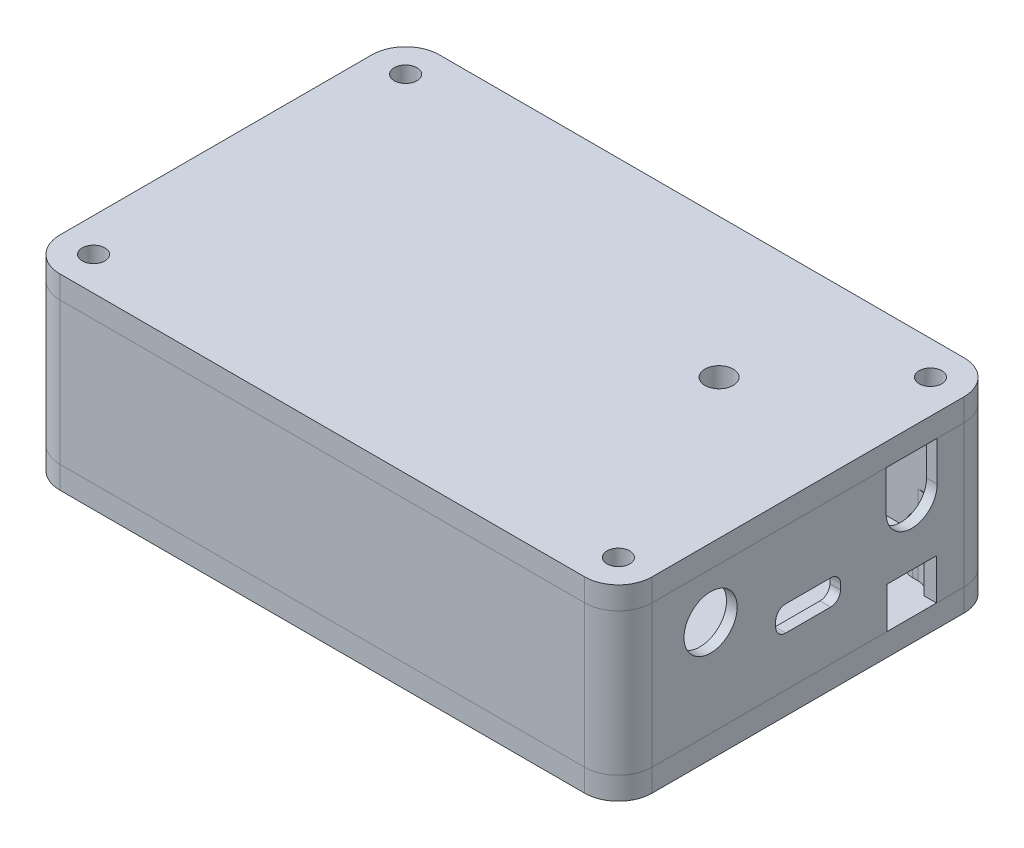
from build123d import *

# Parameters (mm, degrees)
BOSS_EXTRUDE1_DEPTH      = 20.07
SKETCH3_R                = 1.6
BOSS_EXTRUDE2_DEPTH      = 5.5
FILLET1_R                = 2.5
DATA_SIDE_REACH          = 102.265
SKETCH4_R                = 3.25
IO_SIDE_REACH            = 102.265
SKETCH5_R                = 2.15
SKETCH5_W                = 11.9
SKETCH5_H                = 7.3
PLUG_CLEARANCE_REACH     = 102.265
SKETCH10_W               = 11.9
SKETCH10_H               = 2.5
SKETCH10_H_2             = 0.5
MOVE_START               = 79.994994432
MOVE_FACE1_OUTLINE_R     = 3.75
MOVE_FACE1_OUTLINE_R_2   = 3.25
MOVE_FACE1_DEPTH         = 3.005005568
MOVE_START_2             = -3
MOVE_FACE1_2_OUTLINE_R   = 2.65
MOVE_FACE1_2_OUTLINE_R_2 = 2.15
MOVE_FACE1_2_DEPTH       = 82.994994432
MOVE_FACE2_BY            = 0.1
MOVE_FACE2_2_BY          = 0.1
MOVE_FACE2_3_BY          = 0.1
MOVE_FACE2_4_BY          = 0.1
MOVE_FACE2_5_BY          = 0.1
MOVE_FACE2_6_BY          = 0.1
MOVE_FACE2_7_BY          = 0.1
MOVE_FACE2_8_BY          = 0.1
MOVE_FACE2_9_BY          = 0.1
MOVE_FACE2_10_BY         = 0.1
MOVE_FACE3_BY            = 0.1
MOVE_FACE3_2_BY          = 0.1
MOVE_FACE3_3_BY          = 0.1
MOVE_FACE3_4_BY          = 0.1
SKETCH6_R                = 1.6
BOSS_EXTRUDE3_DEPTH      = 3.175
SKETCH7_R                = 2
CUT_EXTRUDE3_DEPTH       = 3.175


with BuildPart() as part:
    # Sketch2 → Boss-Extrude1 (new body)
    with BuildSketch(Plane(origin=(0, 0, 0), x_dir=(1, 0, 0), z_dir=(0, 1, 0))):
        with BuildLine():
            Line((77, 51.75), (3, 51.75))
            ThreePointArc((3, 51.75), (-0.358757211, 50.358757211), (-1.75, 47))
            Line((-1.75, 47), (-1.75, 3))
            ThreePointArc((-1.75, 3), (-0.358757211, -0.358757211), (3, -1.75))
            Line((3, -1.75), (77, -1.75))
            ThreePointArc((77, -1.75), (80.358757211, -0.358757211), (81.75, 3))
            Line((81.75, 3), (81.75, 47))
            ThreePointArc((81.75, 47), (80.358757211, 50.358757211), (77, 51.75))
        make_face()
        with BuildLine():
            Line((-0.25, 47), (-0.25, 3))
            ThreePointArc((-0.25, 3), (0.701902961, 0.701902961), (3, -0.25))
            Line((3, -0.25), (77, -0.25))
            ThreePointArc((77, -0.25), (79.298097039, 0.701902961), (80.25, 3))
            Line((80.25, 3), (80.25, 47))
            ThreePointArc((80.25, 47), (79.298097039, 49.298097039), (77, 50.25))
            Line((77, 50.25), (3, 50.25))
            ThreePointArc((3, 50.25), (0.701902961, 49.298097039), (-0.25, 47))
        make_face(mode=Mode.SUBTRACT)
    extrude(amount=BOSS_EXTRUDE1_DEPTH)

    # Sketch3 → Boss-Extrude2 (add)
    # profile 1 of 4: a face of its own
    with BuildSketch(Plane.XZ):
        with BuildLine():
            ThreePointArc((-0.25, -47), (0.701902961, -49.298097039), (3, -50.25))
            Line((3, -50.25), (5.5, -50.25))
            Line((5.5, -50.25), (5.5, -44.5))
            Line((5.5, -44.5), (-0.25, -44.5))
            Line((-0.25, -44.5), (-0.25, -47))
        make_face()
        with Locations(Location((3, -47, 0), (0, 0, 270))):
            Circle(SKETCH3_R, mode=Mode.SUBTRACT)
    # profile 2 of 4: a face of its own
    with BuildSketch(Plane.XZ):
        with BuildLine():
            Line((74.5, -44.5), (74.5, -50.25))
            Line((74.5, -50.25), (77, -50.25))
            ThreePointArc((77, -50.25), (79.298097039, -49.298097039), (80.25, -47))
            Line((80.25, -47), (80.25, -44.5))
            Line((80.25, -44.5), (74.5, -44.5))
        make_face()
        with Locations(Location((77, -47, 0), (0, 0, 270))):
            Circle(SKETCH3_R, mode=Mode.SUBTRACT)
    # profile 3 of 4: a face of its own
    with BuildSketch(Plane.XZ):
        with BuildLine():
            Line((74.5, -5.5), (80.25, -5.5))
            Line((80.25, -5.5), (80.25, -3))
            ThreePointArc((80.25, -3), (79.298097039, -0.701902961), (77, 0.25))
            Line((77, 0.25), (74.5, 0.25))
            Line((74.5, 0.25), (74.5, -5.5))
        make_face()
        with Locations(Location((77, -3, 0), (0, 0, 270))):
            Circle(SKETCH3_R, mode=Mode.SUBTRACT)
    # profile 4 of 4: a face of its own
    with BuildSketch(Plane.XZ):
        with BuildLine():
            Line((-0.25, -3), (-0.25, -5.5))
            Line((-0.25, -5.5), (5.5, -5.5))
            Line((5.5, -5.5), (5.5, 0.25))
            Line((5.5, 0.25), (3, 0.25))
            ThreePointArc((3, 0.25), (0.701902961, -0.701902961), (-0.25, -3))
        make_face()
        with Locations(Location((3, -3, 0), (0, 0, 270))):
            Circle(SKETCH3_R, mode=Mode.SUBTRACT)
    extrude(amount=-BOSS_EXTRUDE2_DEPTH)

    # Fillet1
    fillet1_edges = [part.edges().sort_by_distance(p)[0] for p in [
        (5.5, 2.75, 0.25),
        (5.5, 2.75, -5.5),
        (-0.25, 2.75, -5.5),
        (5.5, 2.75, -44.5),
        (5.5, 2.75, -50.25),
        (-0.25, 2.75, -44.5),
        (74.5, 2.75, -50.25),
        (74.5, 2.75, -44.5),
        (80.25, 2.75, -44.5),
        (74.5, 2.75, -5.5),
        (74.5, 2.75, 0.25),
        (80.25, 2.75, -5.5),
    ]]
    fillet(fillet1_edges, radius=FILLET1_R)

    # Sketch4 → data side (cut, up to next)
    with BuildSketch(Plane(origin=(81.75, 0, 0), x_dir=(0, 0, -1), z_dir=(1, 0, 0)), mode=Mode.PRIVATE) as data_side_sk1:
        with Locations((11.25, 13.5662)):
            Circle(SKETCH4_R)
    data_side_tool1 = extrude(data_side_sk1.sketch, amount=-DATA_SIDE_REACH, mode=Mode.PRIVATE) & part.part
    # Sketch4 → data side (cut, up to next)
    with BuildSketch(Plane(origin=(81.75, 0, 0), x_dir=(0, 0, -1), z_dir=(1, 0, 0)), mode=Mode.PRIVATE) as data_side_sk2:
        with BuildLine():
            Line((21.83, 7.07), (28.17, 7.07))
            ThreePointArc((28.17, 7.07), (29.089238816, 7.450761184), (29.47, 8.37))
            Line((29.47, 8.37), (29.47, 9.13))
            ThreePointArc((29.47, 9.13), (29.089238816, 10.049238816), (28.17, 10.43))
            Line((28.17, 10.43), (21.83, 10.43))
            ThreePointArc((21.83, 10.43), (20.910761184, 10.049238816), (20.53, 9.13))
            Line((20.53, 9.13), (20.53, 8.37))
            ThreePointArc((20.53, 8.37), (20.910761184, 7.450761184), (21.83, 7.07))
        make_face()
    data_side_tool2 = extrude(data_side_sk2.sketch, amount=-DATA_SIDE_REACH, mode=Mode.PRIVATE) & part.part
    # Sketch4 → data side (cut, up to next)
    with BuildSketch(Plane(origin=(81.75, 0, 0), x_dir=(0, 0, -1), z_dir=(1, 0, 0)), mode=Mode.PRIVATE) as data_side_sk3:
        with BuildLine():
            Line((36.5, 14.4662), (36.5, 20.07))
            ThreePointArc((36.5, 20.07), (39.6, 23.17), (42.7, 20.07))
            Line((42.7, 20.07), (42.7, 14.4662))
            ThreePointArc((42.7, 14.4662), (39.6, 11.3662), (36.5, 14.4662))
        make_face()
    data_side_tool3 = extrude(data_side_sk3.sketch, amount=-DATA_SIDE_REACH, mode=Mode.PRIVATE) & part.part
    # Sketch4 → data side (cut, up to next)
    with BuildSketch(Plane(origin=(81.75, 0, 0), x_dir=(0, 0, -1), z_dir=(1, 0, 0)), mode=Mode.PRIVATE) as data_side_sk4:
        Polygon((36.6, 2.78), (36.6, 5.28), (42.6, 5.28), (42.6, 2.704447838), (42.6, 0), (36.6, 0), align=None)
    data_side_tool4 = extrude(data_side_sk4.sketch, amount=-DATA_SIDE_REACH, mode=Mode.PRIVATE) & part.part
    add(data_side_tool1.solids().sort_by_distance((81.75, 13.5662, -11.25))[0], mode=Mode.SUBTRACT)
    add(data_side_tool2.solids().sort_by_distance((81.75, 8.75, -25))[0], mode=Mode.SUBTRACT)
    add(data_side_tool3.solids().sort_by_distance((81.75, 17.2681, -39.6))[0], mode=Mode.SUBTRACT)
    add(data_side_tool4.solids().sort_by_distance((81.75, 2.64, -39.6))[0], mode=Mode.SUBTRACT)

    # Sketch5 → io side (cut, up to next)
    with BuildSketch(Plane.ZY.offset(1.75), mode=Mode.PRIVATE) as io_side_sk1:
        with Locations((-11.97865482, 11.37450981)):
            Circle(SKETCH5_R)
    io_side_tool1 = extrude(io_side_sk1.sketch, amount=-IO_SIDE_REACH, mode=Mode.PRIVATE) & part.part
    # Sketch5 → io side (cut, up to next)
    with BuildSketch(Plane.ZY.offset(1.75), mode=Mode.PRIVATE) as io_side_sk2:
        with Locations((-25, 9.15)):
            Rectangle(SKETCH5_W, SKETCH5_H)
    io_side_tool2 = extrude(io_side_sk2.sketch, amount=-IO_SIDE_REACH, mode=Mode.PRIVATE) & part.part
    add(io_side_tool1.solids().sort_by_distance((-1.75, 11.37451, -11.978655))[0], mode=Mode.SUBTRACT)
    add(io_side_tool2.solids().sort_by_distance((-1.75, 9.15, -25))[0], mode=Mode.SUBTRACT)

    # Sketch10 → plug clearance (cut, up to next)
    with BuildSketch(Plane.ZY.offset(1.75), mode=Mode.PRIVATE) as plug_clearance_sk1:
        with Locations((-25, 4.25)):
            Rectangle(SKETCH10_W, SKETCH10_H)
    plug_clearance_tool1 = extrude(plug_clearance_sk1.sketch, amount=-PLUG_CLEARANCE_REACH, mode=Mode.PRIVATE) & part.part
    # Sketch10 → plug clearance (cut, up to next)
    with BuildSketch(Plane.ZY.offset(1.75), mode=Mode.PRIVATE) as plug_clearance_sk2:
        with Locations((-25, 13.05)):
            Rectangle(SKETCH10_W, SKETCH10_H_2)
    plug_clearance_tool2 = extrude(plug_clearance_sk2.sketch, amount=-PLUG_CLEARANCE_REACH, mode=Mode.PRIVATE) & part.part
    add(plug_clearance_tool1.solids().sort_by_distance((-1.75, 4.25, -25))[0], mode=Mode.SUBTRACT)
    add(plug_clearance_tool2.solids().sort_by_distance((-1.75, 13.05, -25))[0], mode=Mode.SUBTRACT)

    # Move Face1: read off the stored shape, not the designer's step
    # Move Face1 outline → Move Face1 (cut)
    # profile 1 of 3: a face of its own
    with BuildSketch(Plane.YZ.offset(MOVE_START)):
        Polygon((0, -42.6), (0, -43.1), (5.5, -43.1), (5.78, -43.1), (5.78, -36.1), (0, -36.1), (0, -36.6), (5.28, -36.6), (5.28, -42.6), align=None)
    # profile 2 of 3: a face of its own
    with BuildSketch(Plane.YZ.offset(MOVE_START)):
        with Locations((13.5662, -11.25)):
            Circle(MOVE_FACE1_OUTLINE_R)
        with Locations((13.5662, -11.25)):
            Circle(MOVE_FACE1_OUTLINE_R_2, mode=Mode.SUBTRACT)
    # profile 3 of 3: a face of its own
    with BuildSketch(Plane.YZ.offset(MOVE_START)):
        with BuildLine():
            ThreePointArc((14.4662, -36), (10.8662, -39.6), (14.4662, -43.2))
            Line((14.4662, -43.2), (20.07, -43.2))
            Line((20.07, -43.2), (20.07, -42.7))
            Line((20.07, -42.7), (14.4662, -42.7))
            ThreePointArc((14.4662, -42.7), (11.3662, -39.6), (14.4662, -36.5))
            Line((14.4662, -36.5), (20.07, -36.5))
            Line((20.07, -36.5), (20.07, -36))
            Line((20.07, -36), (14.4662, -36))
        make_face()
    extrude(amount=MOVE_FACE1_DEPTH, mode=Mode.SUBTRACT)

    # Move Face1 2 outline → Move Face1 2 (cut)
    with BuildSketch(Plane.YZ.offset(MOVE_START_2)):
        with Locations((11.37450981, -11.97865482)):
            Circle(MOVE_FACE1_2_OUTLINE_R)
        with Locations((11.37450981, -11.97865482)):
            Circle(MOVE_FACE1_2_OUTLINE_R_2, mode=Mode.SUBTRACT)
    extrude(amount=MOVE_FACE1_2_DEPTH, mode=Mode.SUBTRACT)

    # Move Face2: a face moved inward by 0.1
    extrude(part.faces().sort_by_distance((-1, 8.15, -19.05))[0], amount=MOVE_FACE2_BY, dir=(0, 0, 1), mode=Mode.SUBTRACT)

    # Move Face2 2: a face moved inward by 0.1
    extrude(part.faces().sort_by_distance((-1, 8.15, -30.95))[0], amount=MOVE_FACE2_2_BY, dir=(0, 0, -1), mode=Mode.SUBTRACT)

    # Move Face2 3: a curved face moved inward by 0.1
    add(Solid.thicken(part.faces().sort_by_distance((81, 7.450761184, -29.089238816))[0], -MOVE_FACE2_3_BY), mode=Mode.SUBTRACT)

    # Move Face2 4: a face moved inward by 0.1
    extrude(part.faces().sort_by_distance((81, 10.43, -25))[0], amount=MOVE_FACE2_4_BY, dir=(0, 1, 0), mode=Mode.SUBTRACT)

    # Move Face2 5: a face moved inward by 0.1
    extrude(part.faces().sort_by_distance((81, 8.75, -29.47))[0], amount=MOVE_FACE2_5_BY, dir=(0, 0, -1), mode=Mode.SUBTRACT)

    # Move Face2 6: a curved face moved inward by 0.1
    add(Solid.thicken(part.faces().sort_by_distance((81, 10.049238816, -29.089238816))[0], -MOVE_FACE2_6_BY), mode=Mode.SUBTRACT)

    # Move Face2 7: a curved face moved inward by 0.1
    add(Solid.thicken(part.faces().sort_by_distance((81, 10.049238816, -20.910761184))[0], -MOVE_FACE2_7_BY), mode=Mode.SUBTRACT)

    # Move Face2 8: a face moved inward by 0.1
    extrude(part.faces().sort_by_distance((81, 8.75, -20.53))[0], amount=MOVE_FACE2_8_BY, dir=(0, 0, 1), mode=Mode.SUBTRACT)

    # Move Face2 9: a face moved inward by 0.1
    extrude(part.faces().sort_by_distance((81, 7.07, -25))[0], amount=MOVE_FACE2_9_BY, dir=(0, -1, 0), mode=Mode.SUBTRACT)

    # Move Face2 10: a curved face moved inward by 0.1
    add(Solid.thicken(part.faces().sort_by_distance((81, 7.450761184, -20.910761184))[0], -MOVE_FACE2_10_BY), mode=Mode.SUBTRACT)

    # Move Face3: a curved face moved inward by 0.1
    add(Solid.thicken(part.faces().sort_by_distance((3, 2.75, -45.4))[0], -MOVE_FACE3_BY), mode=Mode.SUBTRACT)

    # Move Face3 2: a curved face moved inward by 0.1
    add(Solid.thicken(part.faces().sort_by_distance((77, 2.75, -45.4))[0], -MOVE_FACE3_2_BY), mode=Mode.SUBTRACT)

    # Move Face3 3: a curved face moved inward by 0.1
    add(Solid.thicken(part.faces().sort_by_distance((77, 2.75, -1.4))[0], -MOVE_FACE3_3_BY), mode=Mode.SUBTRACT)

    # Move Face3 4: a curved face moved inward by 0.1
    add(Solid.thicken(part.faces().sort_by_distance((3, 2.75, -1.4))[0], -MOVE_FACE3_4_BY), mode=Mode.SUBTRACT)


with BuildPart() as body_2:
    # Sketch6 → Boss-Extrude3 (new body)
    with BuildSketch(Plane(origin=(0, 20.07, 0), x_dir=(1, 0, 0), z_dir=(0, 1, 0))):
        with BuildLine():
            Line((3, -1.75), (77, -1.75))
            ThreePointArc((77, -1.75), (80.358757211, -0.358757211), (81.75, 3))
            Line((81.75, 3), (81.75, 47))
            ThreePointArc((81.75, 47), (80.358757211, 50.358757211), (77, 51.75))
            Line((77, 51.75), (3, 51.75))
            ThreePointArc((3, 51.75), (-0.358757211, 50.358757211), (-1.75, 47))
            Line((-1.75, 47), (-1.75, 3))
            ThreePointArc((-1.75, 3), (-0.358757211, -0.358757211), (3, -1.75))
        make_face()
        with Locations(Location((77, 47, 0), (0, 0, 270))):
            Circle(SKETCH6_R, mode=Mode.SUBTRACT)
        with Locations(Location((3, 47, 0), (0, 0, 270))):
            Circle(SKETCH6_R, mode=Mode.SUBTRACT)
        with Locations(Location((77, 3, 0), (0, 0, 270))):
            Circle(SKETCH6_R, mode=Mode.SUBTRACT)
        with Locations(Location((3, 3, 0), (0, 0, 270))):
            Circle(SKETCH6_R, mode=Mode.SUBTRACT)
    extrude(amount=BOSS_EXTRUDE3_DEPTH)


with BuildPart() as body_3:
    # Body-Move/Copy3: copy of body 2
    add(body_2.part.moved(Location((0, -44.867382743, 0))))


with BuildPart() as body_3_1:
    # Body-Move/Copy4: read off the stored shape, not the designer's step
    # Body-Move/Copy4: moved
    add(body_3.part.moved(Location((0, 21.6223827, 0))))


with BuildPart() as body_2_1:
    add(body_2.part)

    # Sketch7 → Cut-Extrude3 (cut)
    with BuildSketch(Plane(origin=(0, 23.245, 0), x_dir=(1, 0, 0), z_dir=(0, 1, 0))):
        with Locations(Location((62.1, 32.1, 0), (0, 0, 270))):
            Circle(SKETCH7_R)
    extrude(amount=-CUT_EXTRUDE3_DEPTH, mode=Mode.SUBTRACT)


solid = Compound([part.part, body_3_1.part, body_2_1.part])
